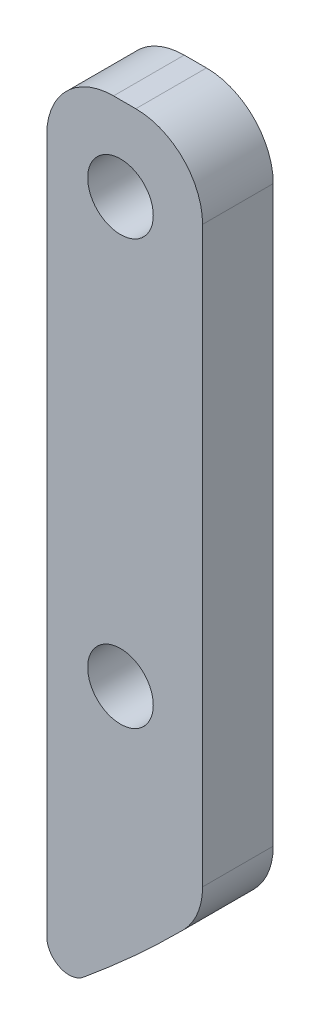
from build123d import *

# Parameters (mm, degrees)
SKETCH1_R           = 1.4732
BOSS_EXTRUDE1_DEPTH = 3.175
FILLET1_R           = 3
FILLET2_R           = 1


with BuildPart() as part:
    # Sketch1 → Boss-Extrude1 (new body)
    with BuildSketch(Plane.XY):
        with BuildLine():
            Line((37.5, -12.587486719), (37.5, -48.86403611))
            ThreePointArc((37.5, -48.86403611), (41.119931518, -45.859516536), (44.5, -42.587486719))
            Line((44.5, -42.587486719), (44.5, -41.365734914))
            Line((44.5, -41.365734914), (44.5, -15.587486719))
            Line((44.5, -15.587486719), (44.5, -12.587486719))
            Line((44.5, -12.587486719), (37.5, -12.587486719))
        make_face()
        with Locations((40.81189221, -16.354311186)):
            Circle(SKETCH1_R, mode=Mode.SUBTRACT)
        with Locations((40.81189221, -35.404311186)):
            Circle(SKETCH1_R, mode=Mode.SUBTRACT)
    extrude(amount=BOSS_EXTRUDE1_DEPTH)

    # Fillet1
    fillet1_edges = [part.edges().sort_by_distance(p)[0] for p in [
        (37.5, -12.587486719, 1.5875),
        (44.5, -12.587486719, 1.5875),
        (44.5, -42.587486719, 1.5875),
    ]]
    fillet(fillet1_edges, radius=FILLET1_R)

    # Fillet2
    fillet2_edges = [part.edges().sort_by_distance(p)[0] for p in [
        (37.5, -48.86403611, 1.5875),
    ]]
    fillet(fillet2_edges, radius=FILLET2_R)


solid = part.part
